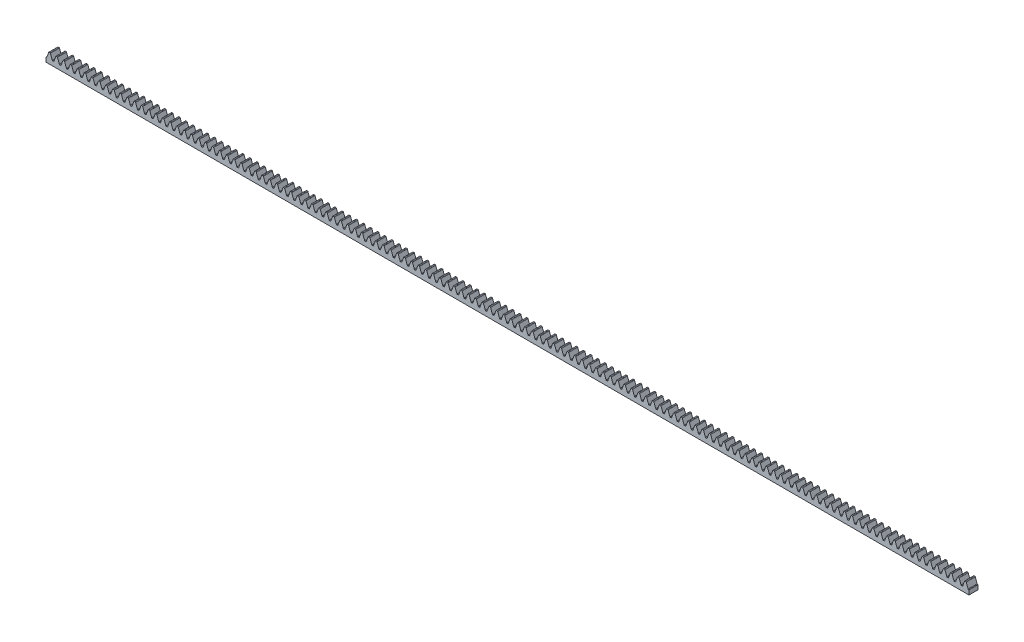
from build123d import *

# Parameters (mm, degrees)
BOSS_EXTRUDE1_DEPTH = 10
LPATTERN2_COUNT     = 130
LPATTERN2_PITCH     = 7.85398


with BuildPart() as part:
    # Sketch1 → Boss-Extrude1 (new body)
    with BuildSketch(Plane.XY):
        with BuildLine():
            Line((-3.926990817, 0), (3.926990817, 0))
            Line((3.926990817, 0), (3.926990817, 5))
            Line((3.926990817, 5), (3.45100616, 5))
            ThreePointArc((3.45100616, 5), (3.164217942, 5.090423978), (2.981159849, 5.328989928))
            Line((2.981159849, 5.328989928), (0.945830968, 10.921010072))
            ThreePointArc((0.945830968, 10.921010072), (0.762772875, 11.159576022), (0.475984657, 11.25))
            Line((0.475984657, 11.25), (-0.475984657, 11.25))
            ThreePointArc((-0.475984657, 11.25), (-0.762772875, 11.159576022), (-0.945830968, 10.921010072))
            Line((-0.945830968, 10.921010072), (-2.981159849, 5.328989928))
            ThreePointArc((-2.981159849, 5.328989928), (-3.164217942, 5.090423978), (-3.45100616, 5))
            Line((-3.45100616, 5), (-3.926990817, 5))
            Line((-3.926990817, 5), (-3.926990817, 0))
        make_face()
    boss_extrude1 = extrude(amount=BOSS_EXTRUDE1_DEPTH)

    # LPattern2: Boss-Extrude1 ×130
    with Locations(*[(-i * LPATTERN2_PITCH, 0, 0) for i in range(1, LPATTERN2_COUNT)]):
        add(boss_extrude1)


solid = part.part
